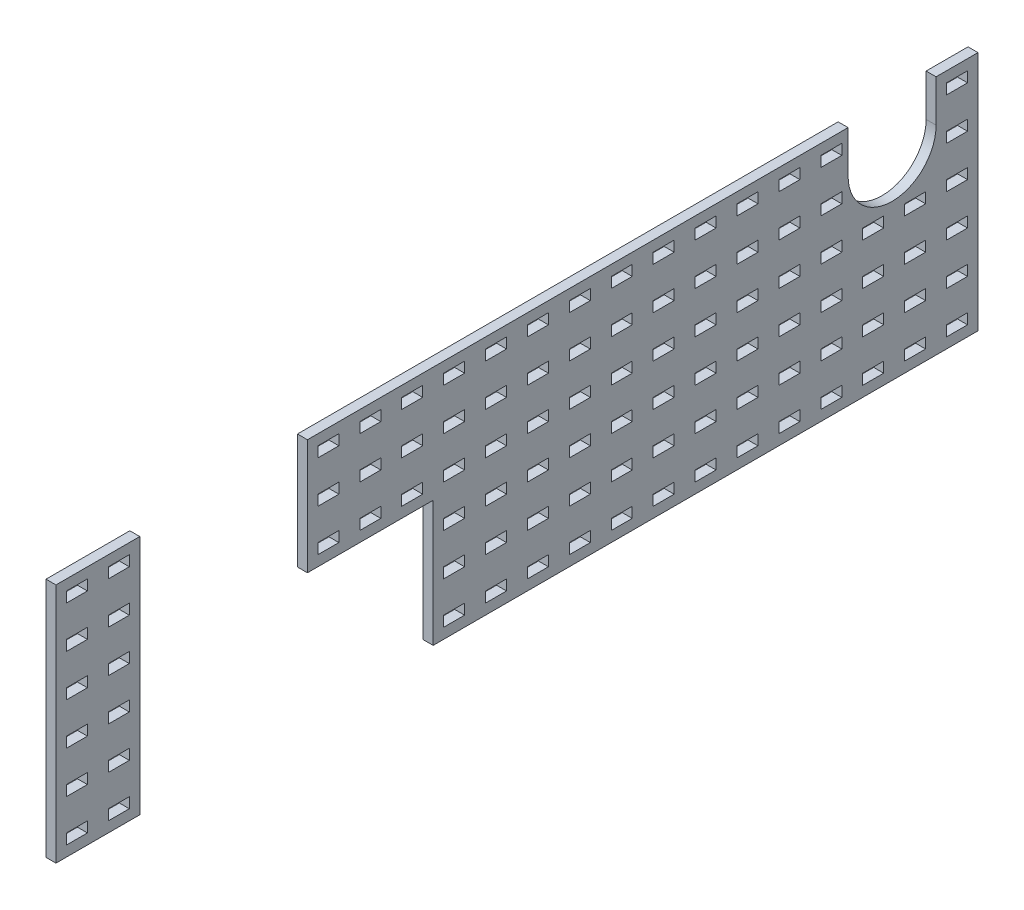
from build123d import *

# Parameters (mm, degrees)
SKETCH1_W           = 558.8
SKETCH1_H           = 146.05
BOSS_EXTRUDE1_DEPTH = 3.0226
SKETCH2_W           = 12.7
SKETCH2_H           = 6.35
CUT_EXTRUDE1_DEPTH  = 289.84867157
SKETCH3_W           = 101.6
SKETCH3_H           = 146.05
CUT_EXTRUDE2_DEPTH  = 289.84867157
CUT_EXTRUDE3_DEPTH  = 289.84867157
SKETCH5_W           = 76.2
SKETCH5_H           = 76.2
CUT_EXTRUDE4_DEPTH  = 289.84867157


with BuildPart() as part:
    # Sketch1 → Boss-Extrude1 (new, symmetric)
    with BuildSketch(Plane(origin=(0, 0, 0), x_dir=(0, 0, -1), z_dir=(1, 0, 0))):
        Rectangle(SKETCH1_W, SKETCH1_H)
    extrude(amount=BOSS_EXTRUDE1_DEPTH, both=True)

    # Sketch2 → Cut-Extrude1 (cut, through all)
    with BuildSketch(Plane(origin=(3.0226, 0, 0), x_dir=(0, 0, -1), z_dir=(1, 0, 0))):
        with Locations((266.7, -63.5)):
            Rectangle(SKETCH2_W, SKETCH2_H)
        with Locations((241.3, -63.5)):
            Rectangle(SKETCH2_W, SKETCH2_H)
        with Locations((215.9, -63.5)):
            Rectangle(SKETCH2_W, SKETCH2_H)
        with Locations((190.5, -63.5)):
            Rectangle(SKETCH2_W, SKETCH2_H)
        with Locations((165.1, -63.5)):
            Rectangle(SKETCH2_W, SKETCH2_H)
        with Locations((139.7, -63.5)):
            Rectangle(SKETCH2_W, SKETCH2_H)
        with Locations((114.3, -63.5)):
            Rectangle(SKETCH2_W, SKETCH2_H)
        with Locations((88.9, -63.5)):
            Rectangle(SKETCH2_W, SKETCH2_H)
        with Locations((63.5, -63.5)):
            Rectangle(SKETCH2_W, SKETCH2_H)
        with Locations((38.1, -63.5)):
            Rectangle(SKETCH2_W, SKETCH2_H)
        with Locations((12.7, -63.5)):
            Rectangle(SKETCH2_W, SKETCH2_H)
        with Locations((-12.7, -63.5)):
            Rectangle(SKETCH2_W, SKETCH2_H)
        with Locations((-38.1, -63.5)):
            Rectangle(SKETCH2_W, SKETCH2_H)
        with Locations((-63.5, -63.5)):
            Rectangle(SKETCH2_W, SKETCH2_H)
        with Locations((-88.9, -63.5)):
            Rectangle(SKETCH2_W, SKETCH2_H)
        with Locations((-114.3, -63.5)):
            Rectangle(SKETCH2_W, SKETCH2_H)
        with Locations((-139.7, -63.5)):
            Rectangle(SKETCH2_W, SKETCH2_H)
        with Locations((-165.1, -63.5)):
            Rectangle(SKETCH2_W, SKETCH2_H)
        with Locations((-190.5, -63.5)):
            Rectangle(SKETCH2_W, SKETCH2_H)
        with Locations((-215.9, -63.5)):
            Rectangle(SKETCH2_W, SKETCH2_H)
        with Locations((-241.3, -63.5)):
            Rectangle(SKETCH2_W, SKETCH2_H)
        with Locations((-266.7, -63.5)):
            Rectangle(SKETCH2_W, SKETCH2_H)
        with Locations((241.3, -38.1)):
            Rectangle(SKETCH2_W, SKETCH2_H)
        with Locations((215.9, -38.1)):
            Rectangle(SKETCH2_W, SKETCH2_H)
        with Locations((190.5, -38.1)):
            Rectangle(SKETCH2_W, SKETCH2_H)
        with Locations((165.1, -38.1)):
            Rectangle(SKETCH2_W, SKETCH2_H)
        with Locations((139.7, -38.1)):
            Rectangle(SKETCH2_W, SKETCH2_H)
        with Locations((114.3, -38.1)):
            Rectangle(SKETCH2_W, SKETCH2_H)
        with Locations((88.9, -38.1)):
            Rectangle(SKETCH2_W, SKETCH2_H)
        with Locations((63.5, -38.1)):
            Rectangle(SKETCH2_W, SKETCH2_H)
        with Locations((38.1, -38.1)):
            Rectangle(SKETCH2_W, SKETCH2_H)
        with Locations((12.7, -38.1)):
            Rectangle(SKETCH2_W, SKETCH2_H)
        with Locations((-12.7, -38.1)):
            Rectangle(SKETCH2_W, SKETCH2_H)
        with Locations((-38.1, -38.1)):
            Rectangle(SKETCH2_W, SKETCH2_H)
        with Locations((-63.5, -38.1)):
            Rectangle(SKETCH2_W, SKETCH2_H)
        with Locations((-88.9, -38.1)):
            Rectangle(SKETCH2_W, SKETCH2_H)
        with Locations((-114.3, -38.1)):
            Rectangle(SKETCH2_W, SKETCH2_H)
        with Locations((-139.7, -38.1)):
            Rectangle(SKETCH2_W, SKETCH2_H)
        with Locations((-165.1, -38.1)):
            Rectangle(SKETCH2_W, SKETCH2_H)
        with Locations((-190.5, -38.1)):
            Rectangle(SKETCH2_W, SKETCH2_H)
        with Locations((-215.9, -38.1)):
            Rectangle(SKETCH2_W, SKETCH2_H)
        with Locations((-241.3, -38.1)):
            Rectangle(SKETCH2_W, SKETCH2_H)
        with Locations((-266.7, -38.1)):
            Rectangle(SKETCH2_W, SKETCH2_H)
        with Locations((241.3, -12.7)):
            Rectangle(SKETCH2_W, SKETCH2_H)
        with Locations((215.9, -12.7)):
            Rectangle(SKETCH2_W, SKETCH2_H)
        with Locations((190.5, -12.7)):
            Rectangle(SKETCH2_W, SKETCH2_H)
        with Locations((165.1, -12.7)):
            Rectangle(SKETCH2_W, SKETCH2_H)
        with Locations((139.7, -12.7)):
            Rectangle(SKETCH2_W, SKETCH2_H)
        with Locations((114.3, -12.7)):
            Rectangle(SKETCH2_W, SKETCH2_H)
        with Locations((88.9, -12.7)):
            Rectangle(SKETCH2_W, SKETCH2_H)
        with Locations((63.5, -12.7)):
            Rectangle(SKETCH2_W, SKETCH2_H)
        with Locations((38.1, -12.7)):
            Rectangle(SKETCH2_W, SKETCH2_H)
        with Locations((12.7, -12.7)):
            Rectangle(SKETCH2_W, SKETCH2_H)
        with Locations((-12.7, -12.7)):
            Rectangle(SKETCH2_W, SKETCH2_H)
        with Locations((-38.1, -12.7)):
            Rectangle(SKETCH2_W, SKETCH2_H)
        with Locations((-63.5, -12.7)):
            Rectangle(SKETCH2_W, SKETCH2_H)
        with Locations((-88.9, -12.7)):
            Rectangle(SKETCH2_W, SKETCH2_H)
        with Locations((-114.3, -12.7)):
            Rectangle(SKETCH2_W, SKETCH2_H)
        with Locations((-139.7, -12.7)):
            Rectangle(SKETCH2_W, SKETCH2_H)
        with Locations((-165.1, -12.7)):
            Rectangle(SKETCH2_W, SKETCH2_H)
        with Locations((-190.5, -12.7)):
            Rectangle(SKETCH2_W, SKETCH2_H)
        with Locations((-215.9, -12.7)):
            Rectangle(SKETCH2_W, SKETCH2_H)
        with Locations((-241.3, -12.7)):
            Rectangle(SKETCH2_W, SKETCH2_H)
        with Locations((-266.7, -12.7)):
            Rectangle(SKETCH2_W, SKETCH2_H)
        with Locations((241.3, 12.7)):
            Rectangle(SKETCH2_W, SKETCH2_H)
        with Locations((215.9, 12.7)):
            Rectangle(SKETCH2_W, SKETCH2_H)
        with Locations((190.5, 12.7)):
            Rectangle(SKETCH2_W, SKETCH2_H)
        with Locations((165.1, 12.7)):
            Rectangle(SKETCH2_W, SKETCH2_H)
        with Locations((139.7, 12.7)):
            Rectangle(SKETCH2_W, SKETCH2_H)
        with Locations((114.3, 12.7)):
            Rectangle(SKETCH2_W, SKETCH2_H)
        with Locations((88.9, 12.7)):
            Rectangle(SKETCH2_W, SKETCH2_H)
        with Locations((63.5, 12.7)):
            Rectangle(SKETCH2_W, SKETCH2_H)
        with Locations((38.1, 12.7)):
            Rectangle(SKETCH2_W, SKETCH2_H)
        with Locations((12.7, 12.7)):
            Rectangle(SKETCH2_W, SKETCH2_H)
        with Locations((-12.7, 12.7)):
            Rectangle(SKETCH2_W, SKETCH2_H)
        with Locations((-38.1, 12.7)):
            Rectangle(SKETCH2_W, SKETCH2_H)
        with Locations((-63.5, 12.7)):
            Rectangle(SKETCH2_W, SKETCH2_H)
        with Locations((-88.9, 12.7)):
            Rectangle(SKETCH2_W, SKETCH2_H)
        with Locations((-114.3, 12.7)):
            Rectangle(SKETCH2_W, SKETCH2_H)
        with Locations((-139.7, 12.7)):
            Rectangle(SKETCH2_W, SKETCH2_H)
        with Locations((-165.1, 12.7)):
            Rectangle(SKETCH2_W, SKETCH2_H)
        with Locations((-190.5, 12.7)):
            Rectangle(SKETCH2_W, SKETCH2_H)
        with Locations((-215.9, 12.7)):
            Rectangle(SKETCH2_W, SKETCH2_H)
        with Locations((-241.3, 12.7)):
            Rectangle(SKETCH2_W, SKETCH2_H)
        with Locations((-266.7, 12.7)):
            Rectangle(SKETCH2_W, SKETCH2_H)
        with Locations((241.3, 38.1)):
            Rectangle(SKETCH2_W, SKETCH2_H)
        with Locations((215.9, 38.1)):
            Rectangle(SKETCH2_W, SKETCH2_H)
        with Locations((190.5, 38.1)):
            Rectangle(SKETCH2_W, SKETCH2_H)
        with Locations((165.1, 38.1)):
            Rectangle(SKETCH2_W, SKETCH2_H)
        with Locations((139.7, 38.1)):
            Rectangle(SKETCH2_W, SKETCH2_H)
        with Locations((114.3, 38.1)):
            Rectangle(SKETCH2_W, SKETCH2_H)
        with Locations((88.9, 38.1)):
            Rectangle(SKETCH2_W, SKETCH2_H)
        with Locations((63.5, 38.1)):
            Rectangle(SKETCH2_W, SKETCH2_H)
        with Locations((38.1, 38.1)):
            Rectangle(SKETCH2_W, SKETCH2_H)
        with Locations((12.7, 38.1)):
            Rectangle(SKETCH2_W, SKETCH2_H)
        with Locations((-12.7, 38.1)):
            Rectangle(SKETCH2_W, SKETCH2_H)
        with Locations((-38.1, 38.1)):
            Rectangle(SKETCH2_W, SKETCH2_H)
        with Locations((-63.5, 38.1)):
            Rectangle(SKETCH2_W, SKETCH2_H)
        with Locations((-88.9, 38.1)):
            Rectangle(SKETCH2_W, SKETCH2_H)
        with Locations((-114.3, 38.1)):
            Rectangle(SKETCH2_W, SKETCH2_H)
        with Locations((-139.7, 38.1)):
            Rectangle(SKETCH2_W, SKETCH2_H)
        with Locations((-165.1, 38.1)):
            Rectangle(SKETCH2_W, SKETCH2_H)
        with Locations((-190.5, 38.1)):
            Rectangle(SKETCH2_W, SKETCH2_H)
        with Locations((-215.9, 38.1)):
            Rectangle(SKETCH2_W, SKETCH2_H)
        with Locations((-241.3, 38.1)):
            Rectangle(SKETCH2_W, SKETCH2_H)
        with Locations((-266.7, 38.1)):
            Rectangle(SKETCH2_W, SKETCH2_H)
        with Locations((241.3, 63.5)):
            Rectangle(SKETCH2_W, SKETCH2_H)
        with Locations((215.9, 63.5)):
            Rectangle(SKETCH2_W, SKETCH2_H)
        with Locations((190.5, 63.5)):
            Rectangle(SKETCH2_W, SKETCH2_H)
        with Locations((165.1, 63.5)):
            Rectangle(SKETCH2_W, SKETCH2_H)
        with Locations((139.7, 63.5)):
            Rectangle(SKETCH2_W, SKETCH2_H)
        with Locations((114.3, 63.5)):
            Rectangle(SKETCH2_W, SKETCH2_H)
        with Locations((88.9, 63.5)):
            Rectangle(SKETCH2_W, SKETCH2_H)
        with Locations((63.5, 63.5)):
            Rectangle(SKETCH2_W, SKETCH2_H)
        with Locations((38.1, 63.5)):
            Rectangle(SKETCH2_W, SKETCH2_H)
        with Locations((12.7, 63.5)):
            Rectangle(SKETCH2_W, SKETCH2_H)
        with Locations((-12.7, 63.5)):
            Rectangle(SKETCH2_W, SKETCH2_H)
        with Locations((-38.1, 63.5)):
            Rectangle(SKETCH2_W, SKETCH2_H)
        with Locations((-63.5, 63.5)):
            Rectangle(SKETCH2_W, SKETCH2_H)
        with Locations((-88.9, 63.5)):
            Rectangle(SKETCH2_W, SKETCH2_H)
        with Locations((-114.3, 63.5)):
            Rectangle(SKETCH2_W, SKETCH2_H)
        with Locations((-139.7, 63.5)):
            Rectangle(SKETCH2_W, SKETCH2_H)
        with Locations((-165.1, 63.5)):
            Rectangle(SKETCH2_W, SKETCH2_H)
        with Locations((-190.5, 63.5)):
            Rectangle(SKETCH2_W, SKETCH2_H)
        with Locations((-215.9, 63.5)):
            Rectangle(SKETCH2_W, SKETCH2_H)
        with Locations((-241.3, 63.5)):
            Rectangle(SKETCH2_W, SKETCH2_H)
        with Locations((-266.7, 63.5)):
            Rectangle(SKETCH2_W, SKETCH2_H)
        with Locations((241.3, 88.9)):
            Rectangle(SKETCH2_W, SKETCH2_H)
        with Locations((215.9, 88.9)):
            Rectangle(SKETCH2_W, SKETCH2_H)
        with Locations((190.5, 88.9)):
            Rectangle(SKETCH2_W, SKETCH2_H)
        with Locations((165.1, 88.9)):
            Rectangle(SKETCH2_W, SKETCH2_H)
        with Locations((139.7, 88.9)):
            Rectangle(SKETCH2_W, SKETCH2_H)
        with Locations((114.3, 88.9)):
            Rectangle(SKETCH2_W, SKETCH2_H)
        with Locations((88.9, 88.9)):
            Rectangle(SKETCH2_W, SKETCH2_H)
        with Locations((63.5, 88.9)):
            Rectangle(SKETCH2_W, SKETCH2_H)
        with Locations((38.1, 88.9)):
            Rectangle(SKETCH2_W, SKETCH2_H)
        with Locations((12.7, 88.9)):
            Rectangle(SKETCH2_W, SKETCH2_H)
        with Locations((-12.7, 88.9)):
            Rectangle(SKETCH2_W, SKETCH2_H)
        with Locations((-38.1, 88.9)):
            Rectangle(SKETCH2_W, SKETCH2_H)
        with Locations((-63.5, 88.9)):
            Rectangle(SKETCH2_W, SKETCH2_H)
        with Locations((-88.9, 88.9)):
            Rectangle(SKETCH2_W, SKETCH2_H)
        with Locations((-114.3, 88.9)):
            Rectangle(SKETCH2_W, SKETCH2_H)
        with Locations((-139.7, 88.9)):
            Rectangle(SKETCH2_W, SKETCH2_H)
        with Locations((-165.1, 88.9)):
            Rectangle(SKETCH2_W, SKETCH2_H)
        with Locations((-190.5, 88.9)):
            Rectangle(SKETCH2_W, SKETCH2_H)
        with Locations((-215.9, 88.9)):
            Rectangle(SKETCH2_W, SKETCH2_H)
        with Locations((-241.3, 88.9)):
            Rectangle(SKETCH2_W, SKETCH2_H)
        with Locations((-266.7, 88.9)):
            Rectangle(SKETCH2_W, SKETCH2_H)
        with Locations((241.3, 114.3)):
            Rectangle(SKETCH2_W, SKETCH2_H)
        with Locations((215.9, 114.3)):
            Rectangle(SKETCH2_W, SKETCH2_H)
        with Locations((190.5, 114.3)):
            Rectangle(SKETCH2_W, SKETCH2_H)
        with Locations((165.1, 114.3)):
            Rectangle(SKETCH2_W, SKETCH2_H)
        with Locations((139.7, 114.3)):
            Rectangle(SKETCH2_W, SKETCH2_H)
        with Locations((114.3, 114.3)):
            Rectangle(SKETCH2_W, SKETCH2_H)
        with Locations((88.9, 114.3)):
            Rectangle(SKETCH2_W, SKETCH2_H)
        with Locations((63.5, 114.3)):
            Rectangle(SKETCH2_W, SKETCH2_H)
        with Locations((38.1, 114.3)):
            Rectangle(SKETCH2_W, SKETCH2_H)
        with Locations((12.7, 114.3)):
            Rectangle(SKETCH2_W, SKETCH2_H)
        with Locations((-12.7, 114.3)):
            Rectangle(SKETCH2_W, SKETCH2_H)
        with Locations((-38.1, 114.3)):
            Rectangle(SKETCH2_W, SKETCH2_H)
        with Locations((-63.5, 114.3)):
            Rectangle(SKETCH2_W, SKETCH2_H)
        with Locations((-88.9, 114.3)):
            Rectangle(SKETCH2_W, SKETCH2_H)
        with Locations((-114.3, 114.3)):
            Rectangle(SKETCH2_W, SKETCH2_H)
        with Locations((-139.7, 114.3)):
            Rectangle(SKETCH2_W, SKETCH2_H)
        with Locations((-165.1, 114.3)):
            Rectangle(SKETCH2_W, SKETCH2_H)
        with Locations((-190.5, 114.3)):
            Rectangle(SKETCH2_W, SKETCH2_H)
        with Locations((-215.9, 114.3)):
            Rectangle(SKETCH2_W, SKETCH2_H)
        with Locations((-241.3, 114.3)):
            Rectangle(SKETCH2_W, SKETCH2_H)
        with Locations((-266.7, 114.3)):
            Rectangle(SKETCH2_W, SKETCH2_H)
        with Locations((241.3, 139.7)):
            Rectangle(SKETCH2_W, SKETCH2_H)
        with Locations((215.9, 139.7)):
            Rectangle(SKETCH2_W, SKETCH2_H)
        with Locations((190.5, 139.7)):
            Rectangle(SKETCH2_W, SKETCH2_H)
        with Locations((165.1, 139.7)):
            Rectangle(SKETCH2_W, SKETCH2_H)
        with Locations((139.7, 139.7)):
            Rectangle(SKETCH2_W, SKETCH2_H)
        with Locations((114.3, 139.7)):
            Rectangle(SKETCH2_W, SKETCH2_H)
        with Locations((88.9, 139.7)):
            Rectangle(SKETCH2_W, SKETCH2_H)
        with Locations((63.5, 139.7)):
            Rectangle(SKETCH2_W, SKETCH2_H)
        with Locations((38.1, 139.7)):
            Rectangle(SKETCH2_W, SKETCH2_H)
        with Locations((12.7, 139.7)):
            Rectangle(SKETCH2_W, SKETCH2_H)
        with Locations((-12.7, 139.7)):
            Rectangle(SKETCH2_W, SKETCH2_H)
        with Locations((-38.1, 139.7)):
            Rectangle(SKETCH2_W, SKETCH2_H)
        with Locations((-63.5, 139.7)):
            Rectangle(SKETCH2_W, SKETCH2_H)
        with Locations((-88.9, 139.7)):
            Rectangle(SKETCH2_W, SKETCH2_H)
        with Locations((-114.3, 139.7)):
            Rectangle(SKETCH2_W, SKETCH2_H)
        with Locations((-139.7, 139.7)):
            Rectangle(SKETCH2_W, SKETCH2_H)
        with Locations((-165.1, 139.7)):
            Rectangle(SKETCH2_W, SKETCH2_H)
        with Locations((-190.5, 139.7)):
            Rectangle(SKETCH2_W, SKETCH2_H)
        with Locations((-215.9, 139.7)):
            Rectangle(SKETCH2_W, SKETCH2_H)
        with Locations((-241.3, 139.7)):
            Rectangle(SKETCH2_W, SKETCH2_H)
        with Locations((-266.7, 139.7)):
            Rectangle(SKETCH2_W, SKETCH2_H)
        with Locations((241.3, 165.1)):
            Rectangle(SKETCH2_W, SKETCH2_H)
        with Locations((215.9, 165.1)):
            Rectangle(SKETCH2_W, SKETCH2_H)
        with Locations((190.5, 165.1)):
            Rectangle(SKETCH2_W, SKETCH2_H)
        with Locations((165.1, 165.1)):
            Rectangle(SKETCH2_W, SKETCH2_H)
        with Locations((139.7, 165.1)):
            Rectangle(SKETCH2_W, SKETCH2_H)
        with Locations((114.3, 165.1)):
            Rectangle(SKETCH2_W, SKETCH2_H)
        with Locations((88.9, 165.1)):
            Rectangle(SKETCH2_W, SKETCH2_H)
        with Locations((63.5, 165.1)):
            Rectangle(SKETCH2_W, SKETCH2_H)
        with Locations((38.1, 165.1)):
            Rectangle(SKETCH2_W, SKETCH2_H)
        with Locations((12.7, 165.1)):
            Rectangle(SKETCH2_W, SKETCH2_H)
        with Locations((-12.7, 165.1)):
            Rectangle(SKETCH2_W, SKETCH2_H)
        with Locations((-38.1, 165.1)):
            Rectangle(SKETCH2_W, SKETCH2_H)
        with Locations((-63.5, 165.1)):
            Rectangle(SKETCH2_W, SKETCH2_H)
        with Locations((-88.9, 165.1)):
            Rectangle(SKETCH2_W, SKETCH2_H)
        with Locations((-114.3, 165.1)):
            Rectangle(SKETCH2_W, SKETCH2_H)
        with Locations((-139.7, 165.1)):
            Rectangle(SKETCH2_W, SKETCH2_H)
        with Locations((-165.1, 165.1)):
            Rectangle(SKETCH2_W, SKETCH2_H)
        with Locations((-190.5, 165.1)):
            Rectangle(SKETCH2_W, SKETCH2_H)
        with Locations((-215.9, 165.1)):
            Rectangle(SKETCH2_W, SKETCH2_H)
        with Locations((-241.3, 165.1)):
            Rectangle(SKETCH2_W, SKETCH2_H)
        with Locations((-266.7, 165.1)):
            Rectangle(SKETCH2_W, SKETCH2_H)
        with Locations((266.7, -38.1)):
            Rectangle(SKETCH2_W, SKETCH2_H)
        with Locations((266.7, -12.7)):
            Rectangle(SKETCH2_W, SKETCH2_H)
        with Locations((266.7, 12.7)):
            Rectangle(SKETCH2_W, SKETCH2_H)
        with Locations((266.7, 38.1)):
            Rectangle(SKETCH2_W, SKETCH2_H)
        with Locations((266.7, 63.5)):
            Rectangle(SKETCH2_W, SKETCH2_H)
        with Locations((266.7, 88.9)):
            Rectangle(SKETCH2_W, SKETCH2_H)
        with Locations((266.7, 114.3)):
            Rectangle(SKETCH2_W, SKETCH2_H)
        with Locations((266.7, 139.7)):
            Rectangle(SKETCH2_W, SKETCH2_H)
        with Locations((266.7, 165.1)):
            Rectangle(SKETCH2_W, SKETCH2_H)
    extrude(amount=-CUT_EXTRUDE1_DEPTH, mode=Mode.SUBTRACT)

    # Sketch3 → Cut-Extrude2 (cut, through all)
    with BuildSketch(Plane(origin=(3.0226, 0, 0), x_dir=(0, 0, -1), z_dir=(1, 0, 0))):
        with Locations((-177.8, 0)):
            Rectangle(SKETCH3_W, SKETCH3_H)
    extrude(amount=-CUT_EXTRUDE2_DEPTH, mode=Mode.SUBTRACT)


with BuildPart() as cut_extrude2_piece_1:
    # of the separate pieces the step leaves, piece 1, a body of its own (cut_extrude2_pieces)
    add(part.part.solids().sort_by_distance((3.0226, -73.025, 127))[0])

    # Sketch4 → Cut-Extrude3 (cut, through all)
    with BuildSketch(Plane(origin=(3.0226, 0, 0), x_dir=(0, 0, -1), z_dir=(1, 0, 0))):
        with BuildLine():
            Line((254, 47.625), (254, 73.025))
            Line((254, 73.025), (200.66, 73.025))
            Line((200.66, 73.025), (200.66, 47.625))
            ThreePointArc((200.66, 47.625), (227.33, 20.955), (254, 47.625))
        make_face()
    extrude(amount=-CUT_EXTRUDE3_DEPTH, mode=Mode.SUBTRACT)

    # Sketch5 → Cut-Extrude4 (cut, through all)
    with BuildSketch(Plane(origin=(3.0226, 0, 0), x_dir=(0, 0, -1), z_dir=(1, 0, 0))):
        with Locations((-88.9, -34.925)):
            Rectangle(SKETCH5_W, SKETCH5_H)
    extrude(amount=-CUT_EXTRUDE4_DEPTH, mode=Mode.SUBTRACT)


with BuildPart() as cut_extrude2_piece_2:
    # of the separate pieces the step leaves, piece 2, a body of its own (cut_extrude2_pieces)
    add(part.part.solids().sort_by_distance((3.0226, -73.025, 279.4))[0])


solid = Compound([cut_extrude2_piece_1.part, cut_extrude2_piece_2.part])
